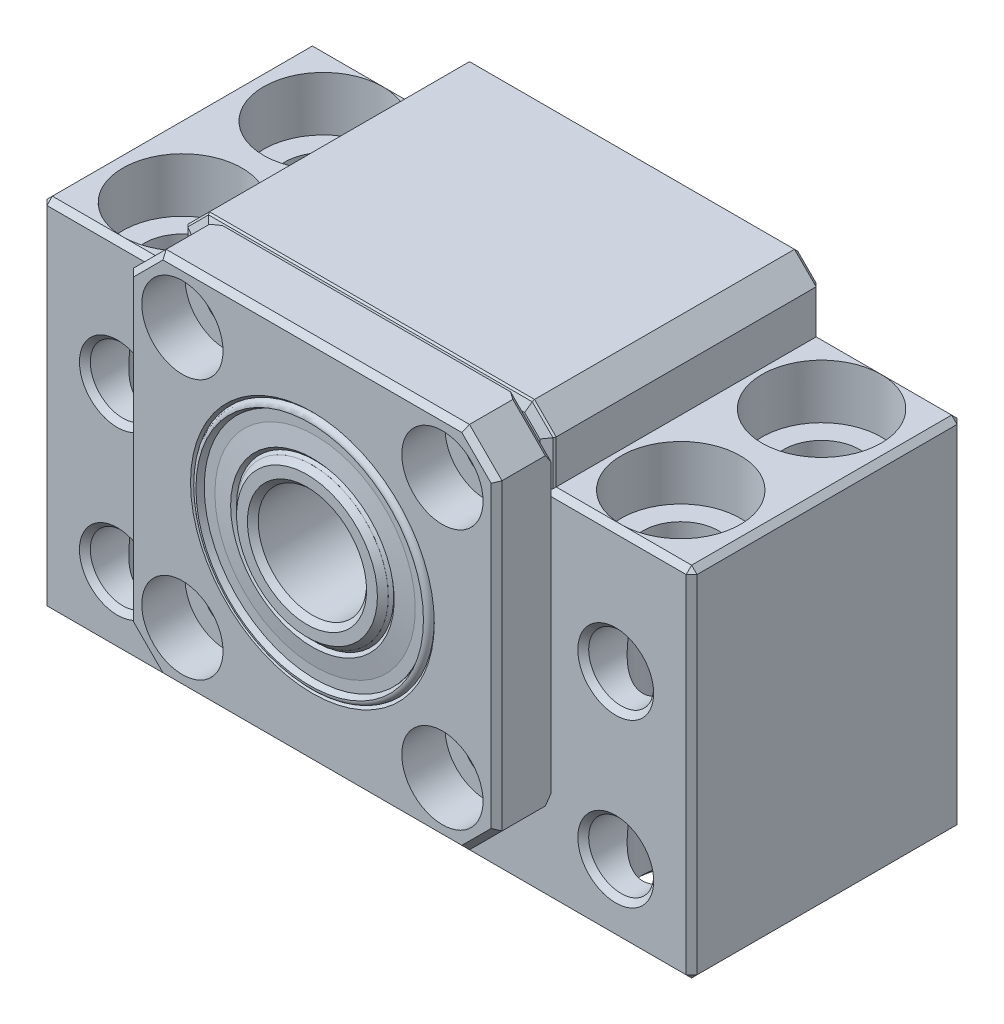
from build123d import *

# Parameters (mm, degrees)
BOSS_EXTRUDE1_DEPTH                    = 12.5
BOSS_EXTRUDE1_DEPTH_BACK               = 12.5
CHAMFER1_SIZE                          = 2
CHAMFER2_SIZE                          = 0.5
SKETCH3_W                              = 34
SKETCH3_H                              = 34
BOSS_EXTRUDE3_DEPTH                    = 5
CHAMFER3_SIZE                          = 3
HOLE_6MM_MOUNT_FRONT_AT_2_COUNT        = 2
HOLE_6MM_MOUNT_FRONT_AT_2_PITCH        = 15
HOLE_6MM_MOUNT_FRONT_AT_3_COUNT        = 2
HOLE_6MM_MOUNT_FRONT_AT_3_PITCH        = 48.383881614
HOLE_6MM_MOUNT_FRONT_AT_4_COUNT        = 2
HOLE_6MM_MOUNT_FRONT_AT_4_PITCH        = 46
HOLES_CAP_AT_2_COUNT                   = 2
HOLES_CAP_AT_2_PITCH                   = 46
HOLES_CAP_AT_3_COUNT                   = 2
HOLES_CAP_AT_3_PITCH                   = 13
HOLES_CAP_AT_4_COUNT                   = 2
HOLES_CAP_AT_4_PITCH                   = 47.801673611
CBORE_FOR_M5_HEX_HEAD_BOLT2_AT_2_COUNT = 2
CBORE_FOR_M5_HEX_HEAD_BOLT2_AT_2_PITCH = 24
CBORE_FOR_M5_HEX_HEAD_BOLT2_AT_3_COUNT = 2
CBORE_FOR_M5_HEX_HEAD_BOLT2_AT_3_PITCH = 33.941125497
CBORE_FOR_M5_HEX_HEAD_BOLT2_AT_4_COUNT = 2
CBORE_FOR_M5_HEX_HEAD_BOLT2_AT_4_PITCH = 24
SKETCH17_W                             = 2
SKETCH17_H                             = 31
CHAMFER4_SIZE                          = 0.5
CHAMFER5_SIZE                          = 0.5
CHAMFER6_SIZE                          = 0.5


with BuildPart() as part:
    # Sketch1 → Boss-Extrude1 (new, two sides: drawn at the far end of the back side and taken through both)
    with BuildSketch(Plane.XY.offset(-BOSS_EXTRUDE1_DEPTH_BACK)):
        Polygon((-17, 17), (17, 17), (17, 11), (30, 11), (30, -22), (-30, -22), (-30, 11), (-17, 11), align=None)
    extrude(amount=BOSS_EXTRUDE1_DEPTH + BOSS_EXTRUDE1_DEPTH_BACK)

    # Chamfer1
    chamfer1_edges = [part.edges().sort_by_distance(p)[0] for p in [
        (-17, 17, 0),
        (17, 17, 0),
    ]]
    chamfer(chamfer1_edges, length=CHAMFER1_SIZE)

    # Chamfer2
    chamfer2_edges = [part.edges().sort_by_distance(p)[0] for p in [
        (17, 13, 12.5),
        (0, 17, 12.5),
        (-17, 13, 12.5),
        (16, 16, 12.5),
        (-16, 16, 12.5),
    ]]
    chamfer(chamfer2_edges, length=CHAMFER2_SIZE)


with BuildPart() as body_2:
    # Sketch3 → Boss-Extrude3 (new body)
    with BuildSketch(Plane.XY.offset(12.5)):
        Rectangle(SKETCH3_W, SKETCH3_H)
    extrude(amount=BOSS_EXTRUDE3_DEPTH)

    # Chamfer3
    chamfer3_edges = [body_2.edges().sort_by_distance(p)[0] for p in [
        (17, -17, 15),
        (-17, -17, 15),
        (-17, 17, 15),
        (17, 17, 15),
    ]]
    chamfer(chamfer3_edges, length=CHAMFER3_SIZE)


with BuildPart() as hole_22mm_bearing_tool:
    # Sketch6 → hole 22mm bearing (revolve)
    with BuildSketch(Plane(origin=(0, 0, -12.5), x_dir=(0, 1, 0), z_dir=(1, 0, 0))):
        Polygon((0, 0), (0, 30), (11.25, 30), (11, 29.75), (11, 0.25), (11.25, 0), align=None)
    revolve(axis=Axis((0, 0, -18.85), (0, 0, 1)))


with BuildPart() as part_1:
    add(part.part)

    # hole 22mm bearing: cut by hole_22mm_bearing_tool
    add(hole_22mm_bearing_tool.part, mode=Mode.SUBTRACT)

    # Sketch7 → hole 6mm mount front (revolve, cut)
    with BuildSketch(Plane(origin=(23, -0.5, -12.5), x_dir=(0, 1, 0), z_dir=(1, 0, 0))):
        Polygon((0, 0), (0, 25), (3.5, 25), (3, 24.5), (3, 0.5), (3.5, 0), align=None)
    hole_6mm_mount_front = revolve(axis=Axis((23, -0.5, -18.85), (0, 0, 1)), mode=Mode.SUBTRACT)

    # hole 6mm mount front at 2: hole 6mm mount front ×2
    with Locations(*[(0, -i * HOLE_6MM_MOUNT_FRONT_AT_2_PITCH, 0) for i in range(1, HOLE_6MM_MOUNT_FRONT_AT_2_COUNT)]):
        add(hole_6mm_mount_front, mode=Mode.SUBTRACT)

    # hole 6mm mount front at 3: hole 6mm mount front ×2
    with Locations(*[Vector(-0.9507298394814788, -0.31002059983091684, 0) * (i * HOLE_6MM_MOUNT_FRONT_AT_3_PITCH) for i in range(1, HOLE_6MM_MOUNT_FRONT_AT_3_COUNT)]):
        add(hole_6mm_mount_front, mode=Mode.SUBTRACT)

    # hole 6mm mount front at 4: hole 6mm mount front ×2
    with Locations(*[(-i * HOLE_6MM_MOUNT_FRONT_AT_4_PITCH, 0, 0) for i in range(1, HOLE_6MM_MOUNT_FRONT_AT_4_COUNT)]):
        add(hole_6mm_mount_front, mode=Mode.SUBTRACT)

    # Sketch11 → holes cap (revolve, cut)
    with BuildSketch(Plane(origin=(23, 11, -6.5), x_dir=(0, 0, 1), z_dir=(1, 0, 0))):
        Polygon((0, 0), (0, 33), (4, 33), (3.5, 32.5), (3.5, 5), (5.5, 5), (5.5, 0), align=None)
    holes_cap = revolve(axis=Axis((23, 17.35, -6.5), (0, -1, 0)), mode=Mode.SUBTRACT)

    # holes cap at 2: holes cap ×2
    with Locations(*[(-i * HOLES_CAP_AT_2_PITCH, 0, 0) for i in range(1, HOLES_CAP_AT_2_COUNT)]):
        add(holes_cap, mode=Mode.SUBTRACT)

    # holes cap at 3: holes cap ×2
    with Locations(*[(0, 0, i * HOLES_CAP_AT_3_PITCH) for i in range(1, HOLES_CAP_AT_3_COUNT)]):
        add(holes_cap, mode=Mode.SUBTRACT)

    # holes cap at 4: holes cap ×2
    with Locations(*[Vector(-0.9623094031071993, 0, 0.2719570052259477) * (i * HOLES_CAP_AT_4_PITCH) for i in range(1, HOLES_CAP_AT_4_COUNT)]):
        add(holes_cap, mode=Mode.SUBTRACT)


with BuildPart() as body_2_1:
    add(body_2.part)

    # hole 22mm bearing: cut by hole_22mm_bearing_tool
    add(hole_22mm_bearing_tool.part, mode=Mode.SUBTRACT)


with BuildPart() as cbore_for_m5_hex_head_bolt2_tool:
    # Sketch12 → CBORE for M5 Hex Head Bolt2 (revolve)
    with BuildSketch(Plane(origin=(-12, 12, 17.5), x_dir=(0, -1, 0), z_dir=(1, 0, 0))):
        Polygon((0, 0), (0, 21.201721238), (2, 20), (2, 4), (3.75, 4), (3.75, 0), align=None)
    cbore_for_m5_hex_head_bolt2 = revolve(axis=Axis((-12, 12, 23.85), (0, 0, -1)))


with BuildPart() as part_2:
    add(part_1.part)

    # CBORE for M5 Hex Head Bolt2: cut by cbore_for_m5_hex_head_bolt2_tool
    add(cbore_for_m5_hex_head_bolt2_tool.part, mode=Mode.SUBTRACT)


with BuildPart() as body_2_2:
    add(body_2_1.part)

    # CBORE for M5 Hex Head Bolt2: cut by cbore_for_m5_hex_head_bolt2_tool
    add(cbore_for_m5_hex_head_bolt2_tool.part, mode=Mode.SUBTRACT)


with BuildPart() as cbore_for_m5_hex_head_bolt2_at_2_tool:
    # CBORE for M5 Hex Head Bolt2 at 2: CBORE for M5 Hex Head Bolt2 ×2
    with Locations(*[(i * CBORE_FOR_M5_HEX_HEAD_BOLT2_AT_2_PITCH, 0, 0) for i in range(1, CBORE_FOR_M5_HEX_HEAD_BOLT2_AT_2_COUNT)]):
        add(cbore_for_m5_hex_head_bolt2)


with BuildPart() as part_3:
    add(part_2.part)

    # CBORE for M5 Hex Head Bolt2 at 2: cut by cbore_for_m5_hex_head_bolt2_at_2_tool
    add(cbore_for_m5_hex_head_bolt2_at_2_tool.part, mode=Mode.SUBTRACT)


with BuildPart() as body_2_3:
    add(body_2_2.part)

    # CBORE for M5 Hex Head Bolt2 at 2: cut by cbore_for_m5_hex_head_bolt2_at_2_tool
    add(cbore_for_m5_hex_head_bolt2_at_2_tool.part, mode=Mode.SUBTRACT)


with BuildPart() as cbore_for_m5_hex_head_bolt2_at_3_tool:
    # CBORE for M5 Hex Head Bolt2 at 3: CBORE for M5 Hex Head Bolt2 ×2
    with Locations(*[Vector(0.7071067811865476, -0.7071067811865476, 0) * (i * CBORE_FOR_M5_HEX_HEAD_BOLT2_AT_3_PITCH) for i in range(1, CBORE_FOR_M5_HEX_HEAD_BOLT2_AT_3_COUNT)]):
        add(cbore_for_m5_hex_head_bolt2)


with BuildPart() as part_4:
    add(part_3.part)

    # CBORE for M5 Hex Head Bolt2 at 3: cut by cbore_for_m5_hex_head_bolt2_at_3_tool
    add(cbore_for_m5_hex_head_bolt2_at_3_tool.part, mode=Mode.SUBTRACT)


with BuildPart() as body_2_4:
    add(body_2_3.part)

    # CBORE for M5 Hex Head Bolt2 at 3: cut by cbore_for_m5_hex_head_bolt2_at_3_tool
    add(cbore_for_m5_hex_head_bolt2_at_3_tool.part, mode=Mode.SUBTRACT)


with BuildPart() as cbore_for_m5_hex_head_bolt2_at_4_tool:
    # CBORE for M5 Hex Head Bolt2 at 4: CBORE for M5 Hex Head Bolt2 ×2
    with Locations(*[(0, -i * CBORE_FOR_M5_HEX_HEAD_BOLT2_AT_4_PITCH, 0) for i in range(1, CBORE_FOR_M5_HEX_HEAD_BOLT2_AT_4_COUNT)]):
        add(cbore_for_m5_hex_head_bolt2)


with BuildPart() as part_5:
    add(part_4.part)

    # CBORE for M5 Hex Head Bolt2 at 4: cut by cbore_for_m5_hex_head_bolt2_at_4_tool
    add(cbore_for_m5_hex_head_bolt2_at_4_tool.part, mode=Mode.SUBTRACT)

    # Chamfer6
    chamfer6_edges = [part_5.edges().sort_by_distance(p)[0] for p in [
        (0, 16.5, 12.5),
        (15.646446609, 15.646446609, 12.5),
        (16.5, 12.896446609, 12.5),
        (-16.5, 12.896446609, 12.5),
        (23.25, 11, 12.5),
        (0, -22, 12.5),
        (-23.25, 11, 12.5),
        (30, -22, 0),
        (30, -5.5, 12.5),
        (30, 11, 0),
        (30, -5.5, -12.5),
        (-30, 11, 0),
        (-30, -5.5, 12.5),
        (-30, -22, 0),
        (0, -22, -12.5),
        (-30, -5.5, -12.5),
        (23.5, 11, -12.5),
        (17, 13, -12.5),
        (16, 16, -12.5),
        (0, 17, -12.5),
        (-16, 16, -12.5),
        (-17, 13, -12.5),
        (-23.5, 11, -12.5),
        (-15.646446609, 15.646446609, 12.5),
    ]]
    chamfer(chamfer6_edges, length=CHAMFER6_SIZE - 0.0001)  # a hair under: the kernel refuses the full size


with BuildPart() as body_2_5:
    add(body_2_4.part)

    # CBORE for M5 Hex Head Bolt2 at 4: cut by cbore_for_m5_hex_head_bolt2_at_4_tool
    add(cbore_for_m5_hex_head_bolt2_at_4_tool.part, mode=Mode.SUBTRACT)

    # Chamfer5
    chamfer5_edges = [body_2_5.edges().sort_by_distance(p)[0] for p in [
        (-17, 0, 17.5),
        (15.5, 15.5, 12.5),
        (15.5, -15.5, 12.5),
        (-15.5, -15.5, 12.5),
        (-15.5, 15.5, 12.5),
        (0, 17, 17.5),
        (17, 0, 17.5),
        (0, -17, 17.5),
        (15.5, 15.5, 17.5),
        (15.5, -15.5, 17.5),
        (-15.5, -15.5, 17.5),
        (-15.5, 15.5, 17.5),
    ]]
    chamfer(chamfer5_edges, length=CHAMFER5_SIZE)


with BuildPart() as body_3:
    # Sketch14 → Revolve1 (revolve)
    with BuildSketch(Plane(origin=(0, 0, 0), x_dir=(1, 0, 0), z_dir=(0, 1, 0))):
        with BuildLine():
            Line((-7, 12.5), (-7, -17.5))
            Line((-7, -17.5), (-7.255531399, -17.25))
            Line((-7.255531399, -17.25), (-7.549700915, -17.5))
            Line((-7.549700915, -17.5), (-9.25, -17.25))
            Line((-9.25, -17.25), (-10.233220897, -17.25))
            Line((-10.233220897, -17.25), (-10.233220897, -17.166161062))
            Line((-10.233220897, -17.166161062), (-10.5, -17.75))
            ThreePointArc((-10.5, -17.75), (-10.853553391, -17.603553391), (-11, -17.25))
            Line((-11, -17.25), (-11, 12.25))
            ThreePointArc((-11, 12.25), (-10.853553391, 12.603553391), (-10.5, 12.75))
            Line((-10.5, 12.75), (-10.233220897, 12.166161062))
            Line((-10.233220897, 12.166161062), (-10.233220897, 12.25))
            Line((-10.233220897, 12.25), (-9.25, 12.25))
            Line((-9.25, 12.25), (-7.549700915, 12.5))
            Line((-7.549700915, 12.5), (-7.255531399, 12.25))
            Line((-7.255531399, 12.25), (-7, 12.5))
        make_face()
    revolve(axis=Axis((0, 0, -12.5), (0, 0, 1)))


with BuildPart() as body_4:
    # Sketch17 → Revolve2 (revolve)
    with BuildSketch(Plane(origin=(0, 0, 0), x_dir=(1, 0, 0), z_dir=(0, 1, 0))):
        with Locations((-6, -2.5)):
            Rectangle(SKETCH17_W, SKETCH17_H)
    revolve(axis=Axis((0, 0, -12.5), (0, 0, 1)))

    # Chamfer4
    chamfer4_edges = [body_4.edges().sort_by_distance(p)[0] for p in [
        (7, 0, -13),
        (5, 0, -13),
        (5, 0, 18),
        (7, 0, 18),
    ]]
    chamfer(chamfer4_edges, length=CHAMFER4_SIZE)


solid = Compound([part_5.part, body_2_5.part, body_3.part, body_4.part])
